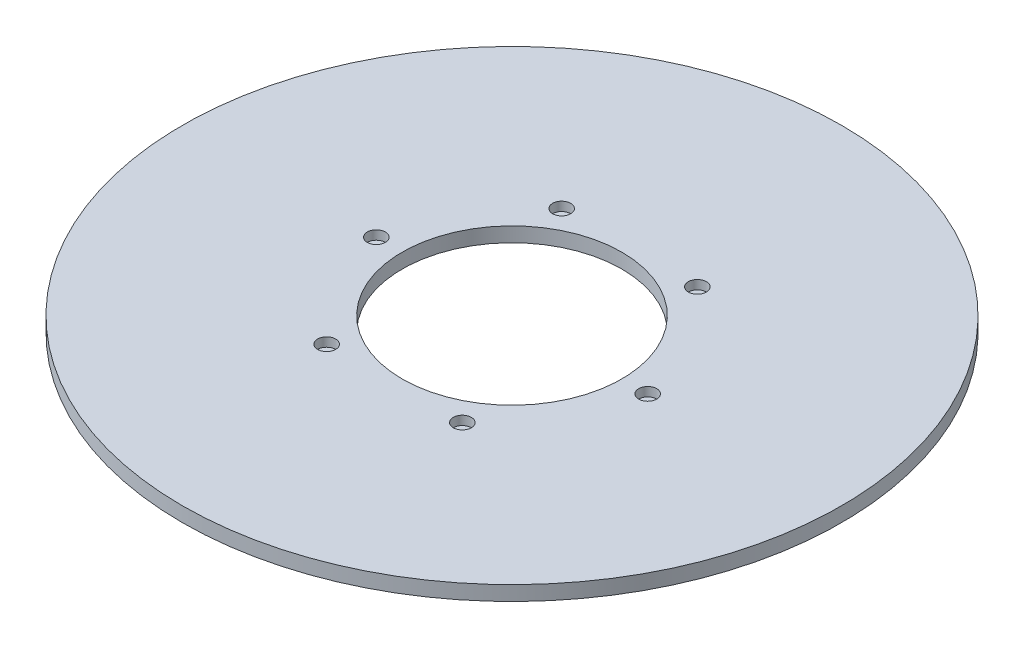
from build123d import *

# Parameters (mm, degrees)
SKETCH1_R           = 90
BOSS_EXTRUDE1_DEPTH = 4
SKETCH2_R           = 30
CUT_EXTRUDE1_DEPTH  = 128.342059038
SKETCH3_R           = 2.468905912
CUT_EXTRUDE2_DEPTH  = 2.459401946
CIRPATTERN1_COUNT   = 6


with BuildPart() as part:
    # Sketch1 → Boss-Extrude1 (new body)
    with BuildSketch(Plane(origin=(0, 0, 0), x_dir=(1, 0, 0), z_dir=(0, 1, 0))):
        Circle(SKETCH1_R)
    extrude(amount=BOSS_EXTRUDE1_DEPTH)

    # Sketch2 → Cut-Extrude1 (cut, through all)
    with BuildSketch(Plane(origin=(0, 0, 0), x_dir=(1, 0, 0), z_dir=(0, 1, 0))):
        Circle(SKETCH2_R)
    extrude(amount=CUT_EXTRUDE1_DEPTH, mode=Mode.SUBTRACT)

    # Sketch3 → Cut-Extrude2 (cut)
    with BuildSketch(Plane(origin=(0, 4, 0), x_dir=(1, 0, 0), z_dir=(0, 1, 0))):
        with Locations((-37.056543623, 0)):
            Circle(SKETCH3_R)
    cut_extrude2 = extrude(amount=-CUT_EXTRUDE2_DEPTH, mode=Mode.SUBTRACT)

    # CirPattern1: Cut-Extrude2 ×6 about axis
    cirpattern1_axis = Axis((0, 0, 0), (0, 1, 0))
    for i in range(1, CIRPATTERN1_COUNT):
        add(cut_extrude2.rotate(cirpattern1_axis, i * 360 / CIRPATTERN1_COUNT), mode=Mode.SUBTRACT)


solid = part.part
